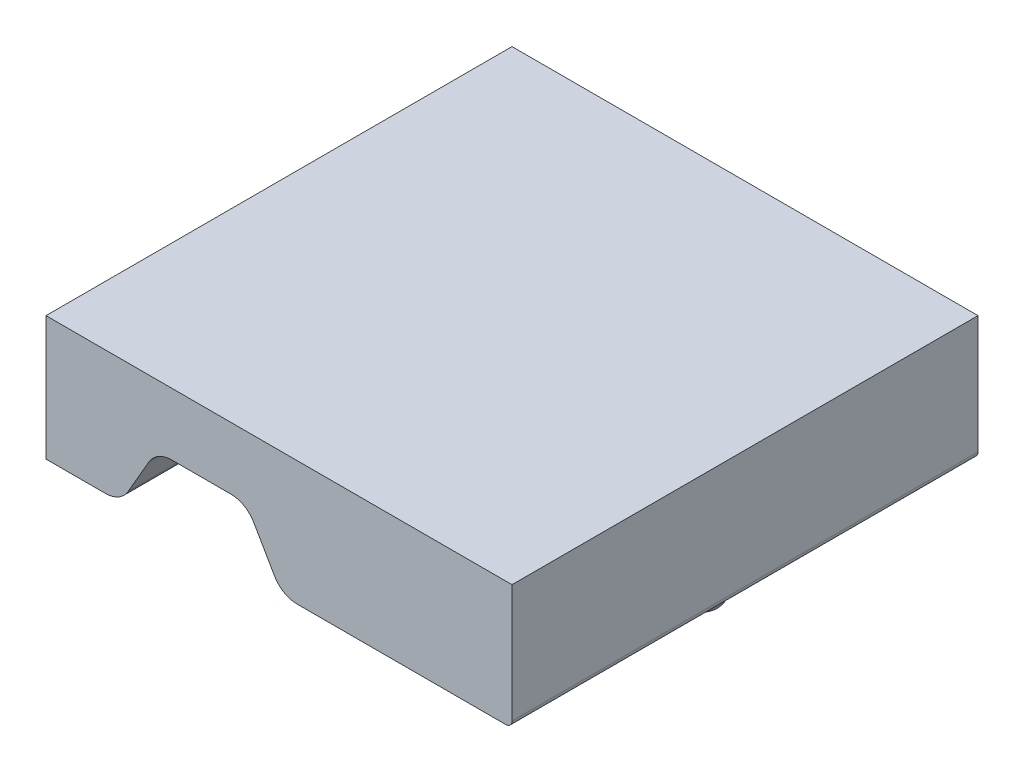
from build123d import *

# Parameters (mm, degrees)
SKETCH1_W           = 762
SKETCH1_H           = 762
BOSS_EXTRUDE1_DEPTH = 203.2
CUT_EXTRUDE1_DEPTH  = 101.6
SKETCH4_W           = 203.2
SKETCH4_H           = 508
CUT_EXTRUDE2_DEPTH  = 76.2
SKETCH6_R           = 12.7
CUT_EXTRUDE3_DEPTH  = 939.426022657
FILLET2_R           = 43.18
SKETCH10_R          = 50.8
BOSS_EXTRUDE2_DEPTH = 17.78
FILLET3_R           = 10.16
FILLET4_R           = 10.16


# Read off the part's stored shape, not the designer's step: Revolve2
with BuildPart() as part:
    # Sketch1 → Boss-Extrude1 (new body)
    with BuildSketch(Plane(origin=(0, 0, 0), x_dir=(1, 0, 0), z_dir=(0, 1, 0))):
        with Locations((254, 0)):
            Rectangle(SKETCH1_W, SKETCH1_H)
    extrude(amount=BOSS_EXTRUDE1_DEPTH)

    # Sketch3 → Cut-Extrude1 (cut)
    with BuildSketch(Plane.XY.offset(381)):
        Polygon((200.323484187, 101.6), (53.676515813, 101.6), (-19.646968374, -25.4), (53.676515813, -152.4), (200.323484187, -152.4), (273.646968374, -25.4), align=None)
    cut_extrude1 = extrude(amount=-CUT_EXTRUDE1_DEPTH, mode=Mode.SUBTRACT)

    # Mirror1: Cut-Extrude1 across plane
    add(cut_extrude1.mirror(Plane.XY), mode=Mode.SUBTRACT)

    # Sketch4 → Cut-Extrude2 (cut)
    with BuildSketch(Plane.XZ):
        with Locations((127, 0)):
            Rectangle(SKETCH4_W, SKETCH4_H)
    extrude(amount=-CUT_EXTRUDE2_DEPTH, mode=Mode.SUBTRACT)

    # Sketch6 → Cut-Extrude3 (cut, through all)
    with BuildSketch(Plane.XY.offset(279.4)):
        with Locations(Location((127, 20.32, 0), (0, 0, 180))):
            Circle(SKETCH6_R)
    extrude(amount=-CUT_EXTRUDE3_DEPTH, mode=Mode.SUBTRACT)

    # Fillet2
    fillet2_edges = [part.edges().sort_by_distance(p)[0] for p in [
        (-4.982271537, 0, 330.2),
        (258.982271537, 0, 330.2),
        (200.323484187, 101.6, 330.2),
        (53.676515813, 101.6, 330.2),
        (-4.982271537, 0, -330.2),
        (258.982271537, 0, -330.2),
        (53.676515813, 101.6, -330.2),
        (200.323484187, 101.6, -330.2),
    ]]
    fillet(fillet2_edges, radius=FILLET2_R)

    # Sketch10 → Boss-Extrude2 (add)
    with BuildSketch(Plane.XZ):
        with Locations(Location((558.8, 0, 0), (0, 0, 90))):
            Circle(SKETCH10_R)
    extrude(amount=BOSS_EXTRUDE2_DEPTH)

    # Sketch12 → Cut-Revolve3 (revolve, cut)
    with BuildSketch(Plane(origin=(0, -17.78, 0), x_dir=(-1, 0, 0), z_dir=(0, -1, 0))):
        with BuildLine():
            Line((-520.7, 0), (-596.9, 0))
            ThreePointArc((-596.9, 0), (-558.8, -38.1), (-520.7, 0))
        make_face()
    revolve(axis=Axis((520.7, -17.78, 0), (1, 0, 0)), mode=Mode.SUBTRACT)

    # Revolve2 outline → Revolve2 (revolve)
    with BuildSketch(Plane(origin=(558.8, 0, 0), x_dir=(1, 0, 0), z_dir=(0, 0, 1))):
        with BuildLine():
            ThreePointArc((38.1, -17.77999996), (36.04252118, -30.130978383), (30.092300919, -41.14800003))
            Line((30.092300919, -41.14800003), (31.071167059, -43.180000031))
            ThreePointArc((31.071167059, -43.180000031), (37.79897817, -31.263867149), (40.132, -17.77999996))
            Line((40.132, -17.77999996), (38.1, -17.77999996))
        make_face()
    revolve(axis=Axis((558.8, 0, 0), (0, 1, 0)))

    # Fillet3
    fillet3_edges = [part.edges().sort_by_distance(p)[0] for p in [
        (558.8, -17.78, -50.8),
    ]]
    fillet(fillet3_edges, radius=FILLET3_R)

    # Fillet4
    fillet4_edges = [part.edges().sort_by_distance(p)[0] for p in [
        (635, 0, 0),
    ]]
    fillet(fillet4_edges, radius=FILLET4_R)


solid = part.part
